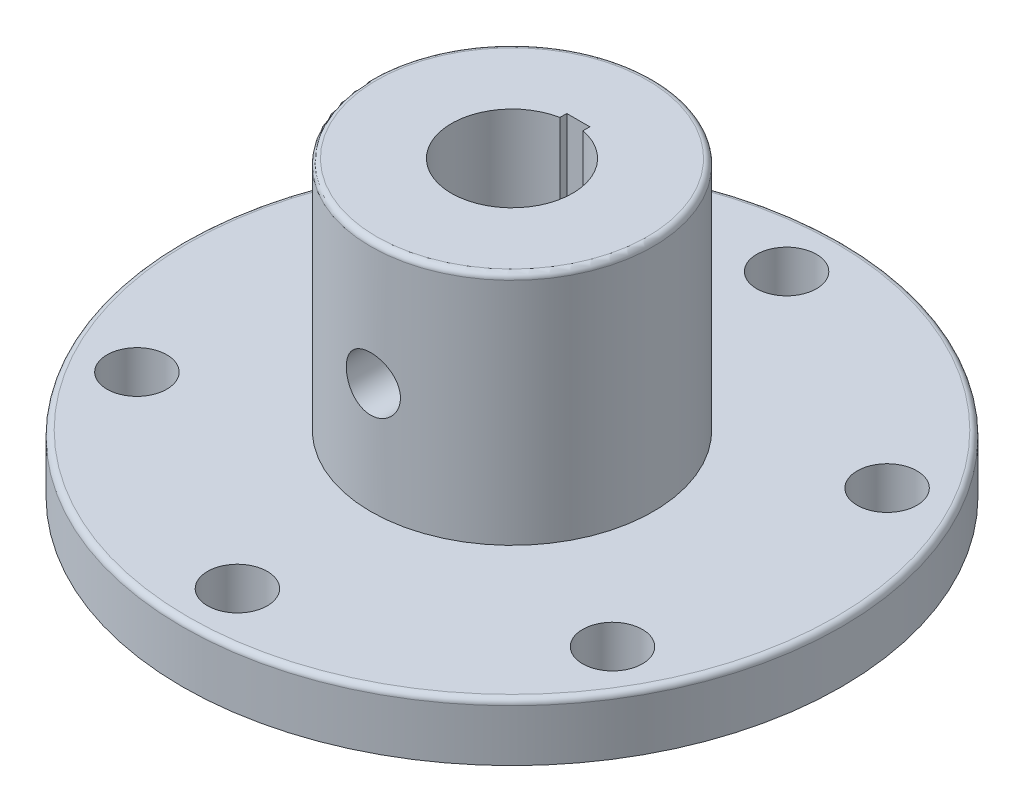
from build123d import *

# Parameters (mm, degrees)
SKETCH1_R           = 28.575
SKETCH1_R_2         = 2.5908
SKETCH1_R_3         = 12.25
BOSS_EXTRUDE1_DEPTH = 5
SKETCH1_3_R         = 12.25
SKETCH1_3_R_2       = 5.25
BOSS_EXTRUDE2_DEPTH = 25.4
FILLET2_R           = 0.5
SKETCH2_W           = 2
SKETCH2_H           = 1
CUT_EXTRUDE1_DEPTH  = 48.730716061
SKETCH3_R           = 2.3495
CUT_EXTRUDE4_DEPTH  = 25.4


with BuildPart() as part:
    # Sketch1 → Boss-Extrude1 (new body)
    with BuildSketch(Plane(origin=(0, 0, 0), x_dir=(1, 0, 0), z_dir=(0, 1, 0))):
        Circle(SKETCH1_R)
        with Locations((-20.622229928, -11.90625)):
            Circle(SKETCH1_R_2, mode=Mode.SUBTRACT)
        with Locations((0, -23.8125)):
            Circle(SKETCH1_R_2, mode=Mode.SUBTRACT)
        with Locations((20.622229928, -11.90625)):
            Circle(SKETCH1_R_2, mode=Mode.SUBTRACT)
        with Locations((-20.622229928, 11.90625)):
            Circle(SKETCH1_R_2, mode=Mode.SUBTRACT)
        Circle(SKETCH1_R_3, mode=Mode.SUBTRACT)
        with Locations((20.622229928, 11.90625)):
            Circle(SKETCH1_R_2, mode=Mode.SUBTRACT)
        with Locations((0, 23.8125)):
            Circle(SKETCH1_R_2, mode=Mode.SUBTRACT)
    extrude(amount=BOSS_EXTRUDE1_DEPTH)

    # Sketch1<3> → Boss-Extrude2 (add)
    with BuildSketch(Plane(origin=(0, 0, 0), x_dir=(1, 0, 0), z_dir=(0, 1, 0))):
        Circle(SKETCH1_3_R)
        Circle(SKETCH1_3_R_2, mode=Mode.SUBTRACT)
    extrude(amount=BOSS_EXTRUDE2_DEPTH)

    # Fillet2
    fillet2_edges = [part.edges().sort_by_distance(p)[0] for p in [
        (-12.25, 25.4, 0),
        (-28.575, 5, 0),
    ]]
    fillet(fillet2_edges, radius=FILLET2_R)

    # Sketch2 → Cut-Extrude1 (cut, through all)
    with BuildSketch(Plane(origin=(0, 25.4, 0), x_dir=(1, 0, 0), z_dir=(0, 1, 0))):
        with Locations((0, 5.25)):
            Rectangle(SKETCH2_W, SKETCH2_H)
    extrude(amount=-CUT_EXTRUDE1_DEPTH, mode=Mode.SUBTRACT)

    # Sketch3 → Cut-Extrude4 (cut)
    with BuildSketch(Plane.XY.offset(-5.75)):
        with Locations((0, 14.590559763)):
            Circle(SKETCH3_R)
    extrude(amount=CUT_EXTRUDE4_DEPTH, mode=Mode.SUBTRACT)


solid = part.part
